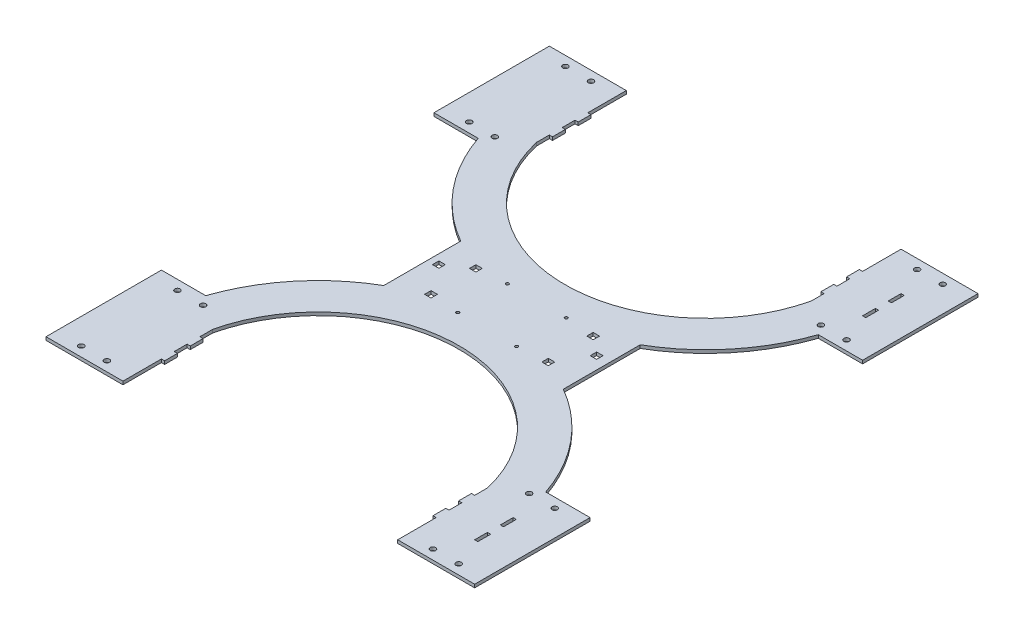
from build123d import *

# Parameters (mm, degrees)
SKETCH1_R           = 2.667
SKETCH1_R_2         = 1.4605
SKETCH1_W           = 3.175
SKETCH1_H           = 12.7
SKETCH1_W_2         = 6.35
SKETCH1_H_2         = 6.35
BOSS_EXTRUDE1_DEPTH = 3.175


with BuildPart() as part:
    # Sketch1 → Boss-Extrude1 (new body)
    with BuildSketch(Plane(origin=(0, 0, 0), x_dir=(1, 0, 0), z_dir=(0, 1, 0))):
        with BuildLine():
            Line((-136.044211564, 57.15), (-212.244211564, 57.15))
            Line((-212.244211564, 57.15), (-212.244211564, -57.15))
            Line((-212.244211564, -57.15), (-168.364834511, -57.15))
            ThreePointArc((-168.364834511, -57.15), (-137.441907425, -112.794335334), (-88.9, -153.979316793))
            Line((-88.9, -153.979316793), (-88.9, -230.179316793))
            ThreePointArc((-88.9, -230.179316793), (-137.441907425, -271.364298252), (-168.364834511, -327.008633586))
            Line((-168.364834511, -327.008633586), (-212.244211564, -327.008633586))
            Line((-212.244211564, -327.008633586), (-212.244211564, -441.308633586))
            Line((-212.244211564, -441.308633586), (-136.044211564, -441.308633586))
            Line((-136.044211564, -441.308633586), (-136.044211564, -403.208633586))
            Line((-136.044211564, -403.208633586), (-132.869211564, -403.208633586))
            Line((-132.869211564, -403.208633586), (-132.869211564, -390.508633586))
            Line((-132.869211564, -390.508633586), (-136.044211564, -390.508633586))
            Line((-136.044211564, -390.508633586), (-136.044211564, -377.808633586))
            Line((-136.044211564, -377.808633586), (-132.869211564, -377.808633586))
            Line((-132.869211564, -377.808633586), (-132.869211564, -365.108633586))
            Line((-132.869211564, -365.108633586), (-136.044211564, -365.108633586))
            Line((-136.044211564, -365.108633586), (-136.044211564, -352.408633586))
            ThreePointArc((-136.044211564, -352.408633586), (0, -244.458633586), (136.044211564, -352.408633586))
            Line((136.044211564, -352.408633586), (136.044211564, -365.108633586))
            Line((136.044211564, -365.108633586), (132.869211564, -365.108633586))
            Line((132.869211564, -365.108633586), (132.869211564, -377.808633586))
            Line((132.869211564, -377.808633586), (136.044211564, -377.808633586))
            Line((136.044211564, -377.808633586), (136.044211564, -390.508633586))
            Line((136.044211564, -390.508633586), (132.869211564, -390.508633586))
            Line((132.869211564, -390.508633586), (132.869211564, -403.208633586))
            Line((132.869211564, -403.208633586), (136.044211564, -403.208633586))
            Line((136.044211564, -403.208633586), (136.044211564, -441.308633586))
            Line((136.044211564, -441.308633586), (212.244211564, -441.308633586))
            Line((212.244211564, -441.308633586), (212.244211564, -327.008633586))
            Line((212.244211564, -327.008633586), (168.364834511, -327.008633586))
            ThreePointArc((168.364834511, -327.008633586), (137.441907425, -271.364298252), (88.9, -230.179316793))
            Line((88.9, -230.179316793), (88.9, -153.979316793))
            ThreePointArc((88.9, -153.979316793), (137.441907425, -112.794335334), (168.364834511, -57.15))
            Line((168.364834511, -57.15), (212.244211564, -57.15))
            Line((212.244211564, -57.15), (212.244211564, 57.15))
            Line((212.244211564, 57.15), (136.044211564, 57.15))
            Line((136.044211564, 57.15), (136.044211564, 19.05))
            Line((136.044211564, 19.05), (132.869211564, 19.05))
            Line((132.869211564, 19.05), (132.869211564, 6.35))
            Line((132.869211564, 6.35), (136.044211564, 6.35))
            Line((136.044211564, 6.35), (136.044211564, -6.35))
            Line((136.044211564, -6.35), (132.869211564, -6.35))
            Line((132.869211564, -6.35), (132.869211564, -19.05))
            Line((132.869211564, -19.05), (136.044211564, -19.05))
            Line((136.044211564, -19.05), (136.044211564, -31.75))
            ThreePointArc((136.044211564, -31.75), (0, -139.7), (-136.044211564, -31.75))
            Line((-136.044211564, -31.75), (-136.044211564, -19.05))
            Line((-136.044211564, -19.05), (-132.869211564, -19.05))
            Line((-132.869211564, -19.05), (-132.869211564, -6.35))
            Line((-132.869211564, -6.35), (-136.044211564, -6.35))
            Line((-136.044211564, -6.35), (-136.044211564, 6.35))
            Line((-136.044211564, 6.35), (-132.869211564, 6.35))
            Line((-132.869211564, 6.35), (-132.869211564, 19.05))
            Line((-132.869211564, 19.05), (-136.044211564, 19.05))
            Line((-136.044211564, 19.05), (-136.044211564, 57.15))
        make_face()
        with Locations((186.844211564, 47.625)):
            Circle(SKETCH1_R, mode=Mode.SUBTRACT)
        with Locations((161.444211564, 47.625)):
            Circle(SKETCH1_R, mode=Mode.SUBTRACT)
        with Locations((186.844211564, -47.625)):
            Circle(SKETCH1_R, mode=Mode.SUBTRACT)
        with Locations((161.444211564, -47.625)):
            Circle(SKETCH1_R, mode=Mode.SUBTRACT)
        with Locations((161.444211564, -336.533633586)):
            Circle(SKETCH1_R, mode=Mode.SUBTRACT)
        with Locations((186.844211564, -336.533633586)):
            Circle(SKETCH1_R, mode=Mode.SUBTRACT)
        with Locations((186.844211564, -431.783633586)):
            Circle(SKETCH1_R, mode=Mode.SUBTRACT)
        with Locations((161.444211564, -431.783633586)):
            Circle(SKETCH1_R, mode=Mode.SUBTRACT)
        with Locations((-186.844211564, 47.625)):
            Circle(SKETCH1_R, mode=Mode.SUBTRACT)
        with Locations((-161.444211564, 47.625)):
            Circle(SKETCH1_R, mode=Mode.SUBTRACT)
        with Locations((-186.844211564, -47.625)):
            Circle(SKETCH1_R, mode=Mode.SUBTRACT)
        with Locations((-161.444211564, -47.625)):
            Circle(SKETCH1_R, mode=Mode.SUBTRACT)
        with Locations((-186.844211564, -336.533633586)):
            Circle(SKETCH1_R, mode=Mode.SUBTRACT)
        with Locations((-161.444211564, -336.533633586)):
            Circle(SKETCH1_R, mode=Mode.SUBTRACT)
        with Locations((-161.444211564, -431.783633586)):
            Circle(SKETCH1_R, mode=Mode.SUBTRACT)
        with Locations((-186.844211564, -431.783633586)):
            Circle(SKETCH1_R, mode=Mode.SUBTRACT)
        with Locations((-29.1465, -167.504816793)):
            Circle(SKETCH1_R_2, mode=Mode.SUBTRACT)
        with Locations((29.1465, -167.504816793)):
            Circle(SKETCH1_R_2, mode=Mode.SUBTRACT)
        with Locations((29.1465, -216.653816793)):
            Circle(SKETCH1_R_2, mode=Mode.SUBTRACT)
        with Locations((-29.1465, -216.653816793)):
            Circle(SKETCH1_R_2, mode=Mode.SUBTRACT)
        with Locations((175.731711564, 12.7)):
            Rectangle(SKETCH1_W, SKETCH1_H, mode=Mode.SUBTRACT)
        with Locations((175.731711564, -12.7)):
            Rectangle(SKETCH1_W, SKETCH1_H, mode=Mode.SUBTRACT)
        with Locations((175.731711564, -371.458633586)):
            Rectangle(SKETCH1_W, SKETCH1_H, mode=Mode.SUBTRACT)
        with Locations((175.731711564, -396.858633586)):
            Rectangle(SKETCH1_W, SKETCH1_H, mode=Mode.SUBTRACT)
        with Locations((-57.967888458, -169.854316793)):
            Rectangle(SKETCH1_W_2, SKETCH1_H_2, mode=Mode.SUBTRACT)
        with Locations((58.146374289, -169.854316793)):
            Rectangle(SKETCH1_W_2, SKETCH1_H_2, mode=Mode.SUBTRACT)
        with Locations((58.146374289, -214.304316793)):
            Rectangle(SKETCH1_W_2, SKETCH1_H_2, mode=Mode.SUBTRACT)
        with Locations((-57.967888458, -214.304316793)):
            Rectangle(SKETCH1_W_2, SKETCH1_H_2, mode=Mode.SUBTRACT)
        with Locations((76.650413974, -184.922154907)):
            Rectangle(SKETCH1_W_2, SKETCH1_H_2, mode=Mode.SUBTRACT)
        with Locations((-79.559586026, -184.922154907)):
            Rectangle(SKETCH1_W_2, SKETCH1_H_2, mode=Mode.SUBTRACT)
    extrude(amount=BOSS_EXTRUDE1_DEPTH)


solid = part.part
